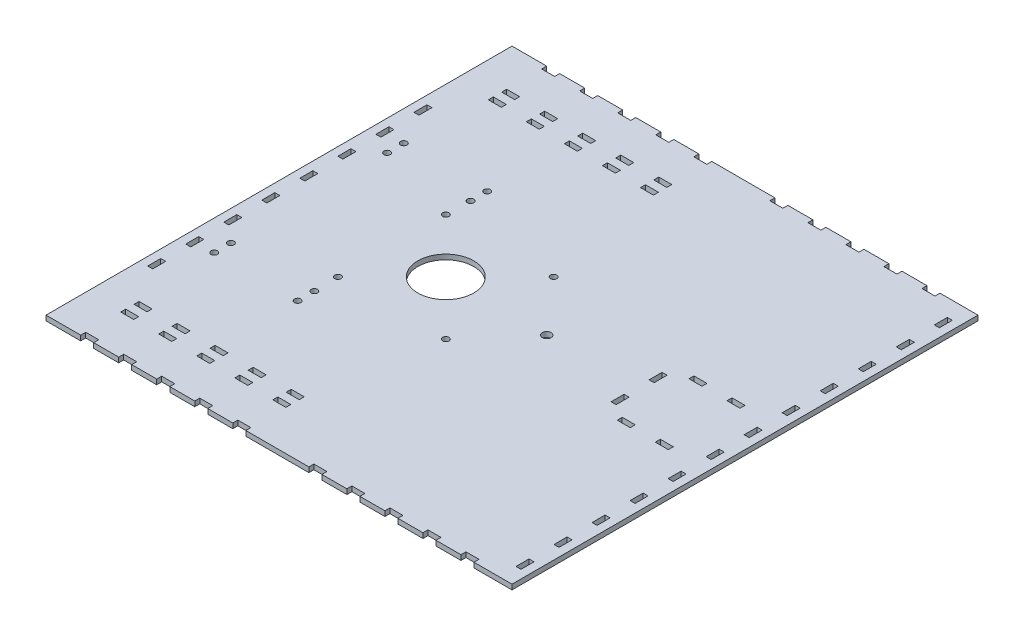
from build123d import *

# Parameters (mm, degrees)
SKETCH1_W                = 279.4
SKETCH1_H                = 279.4
BOSS_EXTRUDE1_DEPTH      = 3
SKETCH3_W                = 3
SKETCH3_H                = 7.8
CUT_EXTRUDE2_DEPTH       = 198.588410591
LPATTERN1_COUNT          = 12
LPATTERN1_PITCH          = 22.8
SKETCH5_W                = 7.8
SKETCH5_H                = 3
CUT_EXTRUDE3_DEPTH       = 198.588410591
LPATTERN2_COUNT          = 11
LPATTERN2_PITCH          = 22.8
MIRROR2_COPY_1_SKETCH_W  = 7.8
MIRROR2_COPY_1_SKETCH_H  = 3
MIRROR2_COPY_1_DEPTH     = 198.588410591
MIRROR2_COPY_2_SKETCH_W  = 7.8
MIRROR2_COPY_2_SKETCH_H  = 3
MIRROR2_COPY_2_DEPTH     = 198.588410591
MIRROR2_COPY_3_SKETCH_W  = 7.8
MIRROR2_COPY_3_SKETCH_H  = 3
MIRROR2_COPY_3_DEPTH     = 198.588410591
MIRROR2_COPY_4_SKETCH_W  = 7.8
MIRROR2_COPY_4_SKETCH_H  = 3
MIRROR2_COPY_4_DEPTH     = 198.588410591
MIRROR2_COPY_5_SKETCH_W  = 7.8
MIRROR2_COPY_5_SKETCH_H  = 3
MIRROR2_COPY_5_DEPTH     = 198.588410591
MIRROR2_COPY_6_SKETCH_W  = 7.8
MIRROR2_COPY_6_SKETCH_H  = 3
MIRROR2_COPY_6_DEPTH     = 198.588410591
MIRROR2_COPY_7_SKETCH_W  = 7.8
MIRROR2_COPY_7_SKETCH_H  = 3
MIRROR2_COPY_7_DEPTH     = 198.588410591
MIRROR2_COPY_8_SKETCH_W  = 7.8
MIRROR2_COPY_8_SKETCH_H  = 3
MIRROR2_COPY_8_DEPTH     = 198.588410591
MIRROR2_COPY_9_SKETCH_W  = 7.8
MIRROR2_COPY_9_SKETCH_H  = 3
MIRROR2_COPY_9_DEPTH     = 198.588410591
MIRROR2_COPY_10_SKETCH_W = 7.8
MIRROR2_COPY_10_SKETCH_H = 3
MIRROR2_COPY_10_DEPTH    = 198.588410591
SKETCH6_W                = 3
SKETCH6_H                = 7.8
CUT_EXTRUDE4_DEPTH       = 198.588410591
LPATTERN3_COUNT          = 8
LPATTERN3_PITCH          = 22.8
SKETCH7_R                = 16.75
CUT_EXTRUDE5_DEPTH       = 198.588410591
F_6_CLEARANCE_HOLE1_D    = 3.7973
F_6_CLEARANCE_HOLE2_D    = 3.7973
SKETCH14_R               = 2.65
CUT_EXTRUDE6_DEPTH       = 198.588410591
SKETCH15_W               = 7.8
SKETCH15_H               = 3
CUT_EXTRUDE7_DEPTH       = 198.588410591
LPATTERN4_COUNT          = 5
LPATTERN4_PITCH          = 22.8
MIRROR3_COPY_1_SKETCH_W  = 7.8
MIRROR3_COPY_1_SKETCH_H  = 3
MIRROR3_COPY_1_DEPTH     = 198.588410591
MIRROR3_COPY_2_SKETCH_W  = 7.8
MIRROR3_COPY_2_SKETCH_H  = 3
MIRROR3_COPY_2_DEPTH     = 198.588410591
MIRROR3_COPY_3_SKETCH_W  = 7.8
MIRROR3_COPY_3_SKETCH_H  = 3
MIRROR3_COPY_3_DEPTH     = 198.588410591
MIRROR3_COPY_4_SKETCH_W  = 7.8
MIRROR3_COPY_4_SKETCH_H  = 3
MIRROR3_COPY_4_DEPTH     = 198.588410591
MIRROR3_COPY_5_SKETCH_W  = 7.8
MIRROR3_COPY_5_SKETCH_H  = 3
MIRROR3_COPY_5_DEPTH     = 198.588410591
SKETCH16_W               = 7.8
SKETCH16_H               = 3
CUT_EXTRUDE8_DEPTH       = 198.588410591
LPATTERN5_COUNT          = 5
LPATTERN5_PITCH          = 22.8
MIRROR4_COPY_1_SKETCH_W  = 7.8
MIRROR4_COPY_1_SKETCH_H  = 3
MIRROR4_COPY_1_DEPTH     = 198.588410591
MIRROR4_COPY_2_SKETCH_W  = 7.8
MIRROR4_COPY_2_SKETCH_H  = 3
MIRROR4_COPY_2_DEPTH     = 198.588410591
MIRROR4_COPY_3_SKETCH_W  = 7.8
MIRROR4_COPY_3_SKETCH_H  = 3
MIRROR4_COPY_3_DEPTH     = 198.588410591
MIRROR4_COPY_4_SKETCH_W  = 7.8
MIRROR4_COPY_4_SKETCH_H  = 3
MIRROR4_COPY_4_DEPTH     = 198.588410591
MIRROR4_COPY_5_SKETCH_W  = 7.8
MIRROR4_COPY_5_SKETCH_H  = 3
MIRROR4_COPY_5_DEPTH     = 198.588410591
SKETCH17_W               = 7.8
SKETCH17_H               = 3
CUT_EXTRUDE9_DEPTH       = 198.588410591
LPATTERN6_COUNT          = 2
LPATTERN6_PITCH          = 22.8
SKETCH18_W               = 3
SKETCH18_H               = 7.8
CUT_EXTRUDE10_DEPTH      = 198.588410591
MIRROR5_COPY_1_SKETCH_W  = 7.8
MIRROR5_COPY_1_SKETCH_H  = 3
MIRROR5_COPY_1_DEPTH     = 198.588410591


with BuildPart() as part:
    # Sketch1 → Boss-Extrude1 (new body)
    with BuildSketch(Plane(origin=(0, 0, 0), x_dir=(1, 0, 0), z_dir=(0, 1, 0))):
        Rectangle(SKETCH1_W, SKETCH1_H)
    extrude(amount=BOSS_EXTRUDE1_DEPTH)

    # Sketch3 → Cut-Extrude2 (cut, through all)
    with BuildSketch(Plane(origin=(0, 0, 0), x_dir=(-1, 0, 0), z_dir=(0, -1, 0))):
        with Locations((-133.2, 125.4)):
            Rectangle(SKETCH3_W, SKETCH3_H)
    cut_extrude2 = extrude(amount=-CUT_EXTRUDE2_DEPTH, mode=Mode.SUBTRACT)

    # LPattern1: Cut-Extrude2 ×12
    with Locations(*[(0, 0, i * LPATTERN1_PITCH) for i in range(1, LPATTERN1_COUNT)]):
        add(cut_extrude2, mode=Mode.SUBTRACT)

    # Sketch5 → Cut-Extrude3 (cut, through all)
    with BuildSketch(Plane.XZ):
        with Locations((113, -138.2)):
            Rectangle(SKETCH5_W, SKETCH5_H)
    cut_extrude3 = extrude(amount=-CUT_EXTRUDE3_DEPTH, mode=Mode.SUBTRACT)

    # LPattern2: Cut-Extrude3 ×11, 1 skipped
    with Locations(*[(-i * LPATTERN2_PITCH, 0, 0) for i in range(1, LPATTERN2_COUNT) if i not in (5,)]):
        add(cut_extrude3, mode=Mode.SUBTRACT)

    # Mirror2 copy 1 sketch → Mirror2 copy 1 (cut, through all)
    with BuildSketch(Plane(origin=(-22.8, 0, 0), x_dir=(1, 0, 0), z_dir=(0, -1, 0))):
        with Locations((113, 138.2)):
            Rectangle(MIRROR2_COPY_1_SKETCH_W, MIRROR2_COPY_1_SKETCH_H)
    extrude(amount=-MIRROR2_COPY_1_DEPTH, mode=Mode.SUBTRACT)

    # Mirror2 copy 2 sketch → Mirror2 copy 2 (cut, through all)
    with BuildSketch(Plane(origin=(-45.6, 0, 0), x_dir=(1, 0, 0), z_dir=(0, -1, 0))):
        with Locations((113, 138.2)):
            Rectangle(MIRROR2_COPY_2_SKETCH_W, MIRROR2_COPY_2_SKETCH_H)
    extrude(amount=-MIRROR2_COPY_2_DEPTH, mode=Mode.SUBTRACT)

    # Mirror2 copy 3 sketch → Mirror2 copy 3 (cut, through all)
    with BuildSketch(Plane(origin=(-68.4, 0, 0), x_dir=(1, 0, 0), z_dir=(0, -1, 0))):
        with Locations((113, 138.2)):
            Rectangle(MIRROR2_COPY_3_SKETCH_W, MIRROR2_COPY_3_SKETCH_H)
    extrude(amount=-MIRROR2_COPY_3_DEPTH, mode=Mode.SUBTRACT)

    # Mirror2 copy 4 sketch → Mirror2 copy 4 (cut, through all)
    with BuildSketch(Plane(origin=(-91.2, 0, 0), x_dir=(1, 0, 0), z_dir=(0, -1, 0))):
        with Locations((113, 138.2)):
            Rectangle(MIRROR2_COPY_4_SKETCH_W, MIRROR2_COPY_4_SKETCH_H)
    extrude(amount=-MIRROR2_COPY_4_DEPTH, mode=Mode.SUBTRACT)

    # Mirror2 copy 5 sketch → Mirror2 copy 5 (cut, through all)
    with BuildSketch(Plane(origin=(-136.8, 0, 0), x_dir=(1, 0, 0), z_dir=(0, -1, 0))):
        with Locations((113, 138.2)):
            Rectangle(MIRROR2_COPY_5_SKETCH_W, MIRROR2_COPY_5_SKETCH_H)
    extrude(amount=-MIRROR2_COPY_5_DEPTH, mode=Mode.SUBTRACT)

    # Mirror2 copy 6 sketch → Mirror2 copy 6 (cut, through all)
    with BuildSketch(Plane(origin=(-159.6, 0, 0), x_dir=(1, 0, 0), z_dir=(0, -1, 0))):
        with Locations((113, 138.2)):
            Rectangle(MIRROR2_COPY_6_SKETCH_W, MIRROR2_COPY_6_SKETCH_H)
    extrude(amount=-MIRROR2_COPY_6_DEPTH, mode=Mode.SUBTRACT)

    # Mirror2 copy 7 sketch → Mirror2 copy 7 (cut, through all)
    with BuildSketch(Plane(origin=(-182.4, 0, 0), x_dir=(1, 0, 0), z_dir=(0, -1, 0))):
        with Locations((113, 138.2)):
            Rectangle(MIRROR2_COPY_7_SKETCH_W, MIRROR2_COPY_7_SKETCH_H)
    extrude(amount=-MIRROR2_COPY_7_DEPTH, mode=Mode.SUBTRACT)

    # Mirror2 copy 8 sketch → Mirror2 copy 8 (cut, through all)
    with BuildSketch(Plane(origin=(-205.2, 0, 0), x_dir=(1, 0, 0), z_dir=(0, -1, 0))):
        with Locations((113, 138.2)):
            Rectangle(MIRROR2_COPY_8_SKETCH_W, MIRROR2_COPY_8_SKETCH_H)
    extrude(amount=-MIRROR2_COPY_8_DEPTH, mode=Mode.SUBTRACT)

    # Mirror2 copy 9 sketch → Mirror2 copy 9 (cut, through all)
    with BuildSketch(Plane(origin=(-228, 0, 0), x_dir=(1, 0, 0), z_dir=(0, -1, 0))):
        with Locations((113, 138.2)):
            Rectangle(MIRROR2_COPY_9_SKETCH_W, MIRROR2_COPY_9_SKETCH_H)
    extrude(amount=-MIRROR2_COPY_9_DEPTH, mode=Mode.SUBTRACT)

    # Mirror2 copy 10 sketch → Mirror2 copy 10 (cut, through all)
    with BuildSketch(Plane.XZ):
        with Locations((113, 138.2)):
            Rectangle(MIRROR2_COPY_10_SKETCH_W, MIRROR2_COPY_10_SKETCH_H)
    extrude(amount=-MIRROR2_COPY_10_DEPTH, mode=Mode.SUBTRACT)

    # Sketch6 → Cut-Extrude4 (cut, through all)
    with BuildSketch(Plane.XZ):
        with Locations((-133.2, -79.8)):
            Rectangle(SKETCH6_W, SKETCH6_H)
    cut_extrude4 = extrude(amount=-CUT_EXTRUDE4_DEPTH, mode=Mode.SUBTRACT)

    # LPattern3: Cut-Extrude4 ×8
    with Locations(*[(0, 0, i * LPATTERN3_PITCH) for i in range(1, LPATTERN3_COUNT)]):
        add(cut_extrude4, mode=Mode.SUBTRACT)

    # Sketch7 → Cut-Extrude5 (cut, through all)
    with BuildSketch(Plane(origin=(0, 0, 0), x_dir=(-1, 0, 0), z_dir=(0, -1, 0))):
        with Locations((39.7, 0)):
            Circle(SKETCH7_R)
    extrude(amount=-CUT_EXTRUDE5_DEPTH, mode=Mode.SUBTRACT)

    # #6 Clearance Hole1 (through all)
    with Locations(Plane(origin=(0, 3, 0), x_dir=(1, 0, 0), z_dir=(0, 1, 0))):
        with Locations((-72.025, -32.325), (-72.025, 32.325), (-7.375, 32.325), (-7.375, -32.325)):
            Hole(F_6_CLEARANCE_HOLE1_D / 2)

    # #6 Clearance Hole2 (through all)
    with Locations(Plane(origin=(0, 3, 0), x_dir=(1, 0, 0), z_dir=(0, 1, 0))):
        with Locations((-121.7, 56.83), (-71.7, 56.83), (-121.7, -56.83), (-71.7, -56.83), (-71.7, -46.83), (-121.7, -46.83), (-71.7, 46.83), (-121.7, 46.83)):
            Hole(F_6_CLEARANCE_HOLE2_D / 2)

    # Sketch14 → Cut-Extrude6 (cut, through all)
    with BuildSketch(Plane(origin=(0, 0, 0), x_dir=(-1, 0, 0), z_dir=(0, -1, 0))):
        with Locations((-20.8, 0)):
            Circle(SKETCH14_R)
    extrude(amount=-CUT_EXTRUDE6_DEPTH, mode=Mode.SUBTRACT)

    # Sketch15 → Cut-Extrude7 (cut, through all)
    with BuildSketch(Plane(origin=(0, 0, 0), x_dir=(-1, 0, 0), z_dir=(0, -1, 0))):
        with Locations((115, -114.2)):
            Rectangle(SKETCH15_W, SKETCH15_H)
    cut_extrude7 = extrude(amount=-CUT_EXTRUDE7_DEPTH, mode=Mode.SUBTRACT)

    # LPattern4: Cut-Extrude7 ×5
    with Locations(*[(i * LPATTERN4_PITCH, 0, 0) for i in range(1, LPATTERN4_COUNT)]):
        add(cut_extrude7, mode=Mode.SUBTRACT)

    # Mirror3 copy 1 sketch → Mirror3 copy 1 (cut, through all)
    with BuildSketch(Plane(origin=(22.8, 0, 0), x_dir=(-1, 0, 0), z_dir=(0, -1, 0))):
        with Locations((115, 114.2)):
            Rectangle(MIRROR3_COPY_1_SKETCH_W, MIRROR3_COPY_1_SKETCH_H)
    extrude(amount=-MIRROR3_COPY_1_DEPTH, mode=Mode.SUBTRACT)

    # Mirror3 copy 2 sketch → Mirror3 copy 2 (cut, through all)
    with BuildSketch(Plane(origin=(45.6, 0, 0), x_dir=(-1, 0, 0), z_dir=(0, -1, 0))):
        with Locations((115, 114.2)):
            Rectangle(MIRROR3_COPY_2_SKETCH_W, MIRROR3_COPY_2_SKETCH_H)
    extrude(amount=-MIRROR3_COPY_2_DEPTH, mode=Mode.SUBTRACT)

    # Mirror3 copy 3 sketch → Mirror3 copy 3 (cut, through all)
    with BuildSketch(Plane(origin=(68.4, 0, 0), x_dir=(-1, 0, 0), z_dir=(0, -1, 0))):
        with Locations((115, 114.2)):
            Rectangle(MIRROR3_COPY_3_SKETCH_W, MIRROR3_COPY_3_SKETCH_H)
    extrude(amount=-MIRROR3_COPY_3_DEPTH, mode=Mode.SUBTRACT)

    # Mirror3 copy 4 sketch → Mirror3 copy 4 (cut, through all)
    with BuildSketch(Plane(origin=(91.2, 0, 0), x_dir=(-1, 0, 0), z_dir=(0, -1, 0))):
        with Locations((115, 114.2)):
            Rectangle(MIRROR3_COPY_4_SKETCH_W, MIRROR3_COPY_4_SKETCH_H)
    extrude(amount=-MIRROR3_COPY_4_DEPTH, mode=Mode.SUBTRACT)

    # Mirror3 copy 5 sketch → Mirror3 copy 5 (cut, through all)
    with BuildSketch(Plane(origin=(0, 0, 0), x_dir=(-1, 0, 0), z_dir=(0, -1, 0))):
        with Locations((115, 114.2)):
            Rectangle(MIRROR3_COPY_5_SKETCH_W, MIRROR3_COPY_5_SKETCH_H)
    extrude(amount=-MIRROR3_COPY_5_DEPTH, mode=Mode.SUBTRACT)

    # Sketch16 → Cut-Extrude8 (cut, through all)
    with BuildSketch(Plane.XZ):
        with Locations((-115, 106.2)):
            Rectangle(SKETCH16_W, SKETCH16_H)
    cut_extrude8 = extrude(amount=-CUT_EXTRUDE8_DEPTH, mode=Mode.SUBTRACT)

    # LPattern5: Cut-Extrude8 ×5
    with Locations(*[(i * LPATTERN5_PITCH, 0, 0) for i in range(1, LPATTERN5_COUNT)]):
        add(cut_extrude8, mode=Mode.SUBTRACT)

    # Mirror4 copy 1 sketch → Mirror4 copy 1 (cut, through all)
    with BuildSketch(Plane(origin=(22.8, 0, 0), x_dir=(1, 0, 0), z_dir=(0, -1, 0))):
        with Locations((-115, -106.2)):
            Rectangle(MIRROR4_COPY_1_SKETCH_W, MIRROR4_COPY_1_SKETCH_H)
    extrude(amount=-MIRROR4_COPY_1_DEPTH, mode=Mode.SUBTRACT)

    # Mirror4 copy 2 sketch → Mirror4 copy 2 (cut, through all)
    with BuildSketch(Plane(origin=(45.6, 0, 0), x_dir=(1, 0, 0), z_dir=(0, -1, 0))):
        with Locations((-115, -106.2)):
            Rectangle(MIRROR4_COPY_2_SKETCH_W, MIRROR4_COPY_2_SKETCH_H)
    extrude(amount=-MIRROR4_COPY_2_DEPTH, mode=Mode.SUBTRACT)

    # Mirror4 copy 3 sketch → Mirror4 copy 3 (cut, through all)
    with BuildSketch(Plane(origin=(68.4, 0, 0), x_dir=(1, 0, 0), z_dir=(0, -1, 0))):
        with Locations((-115, -106.2)):
            Rectangle(MIRROR4_COPY_3_SKETCH_W, MIRROR4_COPY_3_SKETCH_H)
    extrude(amount=-MIRROR4_COPY_3_DEPTH, mode=Mode.SUBTRACT)

    # Mirror4 copy 4 sketch → Mirror4 copy 4 (cut, through all)
    with BuildSketch(Plane(origin=(91.2, 0, 0), x_dir=(1, 0, 0), z_dir=(0, -1, 0))):
        with Locations((-115, -106.2)):
            Rectangle(MIRROR4_COPY_4_SKETCH_W, MIRROR4_COPY_4_SKETCH_H)
    extrude(amount=-MIRROR4_COPY_4_DEPTH, mode=Mode.SUBTRACT)

    # Mirror4 copy 5 sketch → Mirror4 copy 5 (cut, through all)
    with BuildSketch(Plane.XZ):
        with Locations((-115, -106.2)):
            Rectangle(MIRROR4_COPY_5_SKETCH_W, MIRROR4_COPY_5_SKETCH_H)
    extrude(amount=-MIRROR4_COPY_5_DEPTH, mode=Mode.SUBTRACT)

    # Sketch17 → Cut-Extrude9 (cut, through all)
    with BuildSketch(Plane.XZ):
        with Locations((112.8, 21.5)):
            Rectangle(SKETCH17_W, SKETCH17_H)
    cut_extrude9 = extrude(amount=-CUT_EXTRUDE9_DEPTH, mode=Mode.SUBTRACT)

    # LPattern6: Cut-Extrude9 ×2
    with Locations(*[(-i * LPATTERN6_PITCH, 0, 0) for i in range(1, LPATTERN6_COUNT)]):
        add(cut_extrude9, mode=Mode.SUBTRACT)

    # Sketch18 → Cut-Extrude10 (cut, through all)
    with BuildSketch(Plane(origin=(0, 0, 0), x_dir=(-1, 0, 0), z_dir=(0, -1, 0))):
        with Locations((-76.2, -11.4)):
            Rectangle(SKETCH18_W, SKETCH18_H)
    cut_extrude10 = extrude(amount=-CUT_EXTRUDE10_DEPTH, mode=Mode.SUBTRACT)

    # Mirror5: Cut-Extrude9, Cut-Extrude10 across plane
    add(cut_extrude9.mirror(Plane.XY), mode=Mode.SUBTRACT)
    add(cut_extrude10.mirror(Plane.XY), mode=Mode.SUBTRACT)

    # Mirror5 copy 1 sketch → Mirror5 copy 1 (cut, through all)
    with BuildSketch(Plane(origin=(-22.8, 0, 0), x_dir=(1, 0, 0), z_dir=(0, -1, 0))):
        with Locations((112.8, -21.5)):
            Rectangle(MIRROR5_COPY_1_SKETCH_W, MIRROR5_COPY_1_SKETCH_H)
    extrude(amount=-MIRROR5_COPY_1_DEPTH, mode=Mode.SUBTRACT)


solid = part.part
